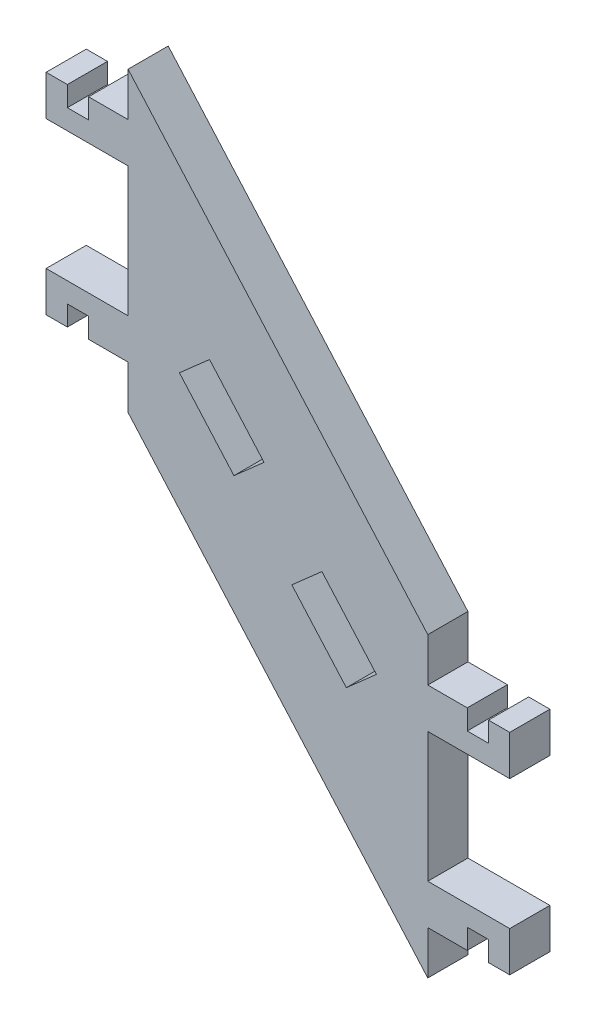
from build123d import *

# Parameters (mm, degrees)
PROFILE_DEPTH      = 6
CUT_EXTRUDE1_DEPTH = 93.862011134


with BuildPart() as part:
    # Sketch1 → Profile (new body)
    with BuildSketch(Plane.XY):
        Polygon((-44.8, 73.025), (-44.8, 66.5), (-50.699999884, 66.5), (-50.699999884, 63.5), (-53.874999884, 63.5), (-53.874999884, 66.5), (-57.049999884, 66.5), (-57.049999884, 60.5), (-44.8, 60.5), (-44.8, 41.1), (-57.049999884, 41.1), (-57.049999884, 35.1), (-53.874999884, 35.1), (-53.874999884, 38.1), (-50.699999884, 38.1), (-50.699999884, 35.1), (-44.8, 35.1), (-44.8, 28.575), (0, -22.225), (0, -15.7), (5.899999884, -15.7), (5.899999884, -12.7), (9.074999884, -12.7), (9.074999884, -15.7), (12.249999884, -15.7), (12.249999884, -9.7), (0, -9.7), (0, 9.7), (12.249999884, 9.7), (12.249999884, 15.7), (9.074999884, 15.7), (9.074999884, 12.7), (5.899999884, 12.7), (5.899999884, 15.7), (0, 15.7), (0, 22.225), align=None)
    extrude(amount=PROFILE_DEPTH)

    # Sketch2 → Cut-Extrude1 (cut, through all)
    with BuildSketch(Plane.XY.offset(6)):
        Polygon((-32.624138689, 41.529095701), (-37.124199675, 37.560537981), (-28.976089166, 28.321162671), (-24.47602818, 32.289720391), align=None)
        Polygon((-15.823910834, 22.478837329), (-7.675800325, 13.239462019), (-12.175861311, 9.270904299), (-20.32397182, 18.510279609), align=None)
    extrude(amount=-CUT_EXTRUDE1_DEPTH, mode=Mode.SUBTRACT)


solid = part.part
